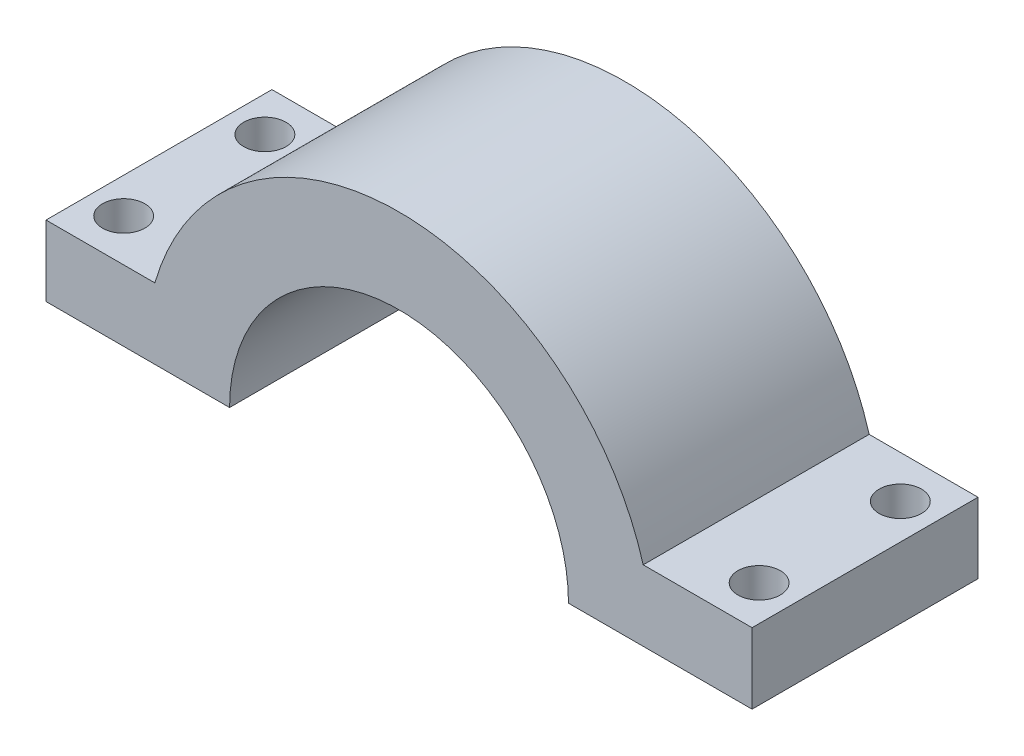
from build123d import *

# Parameters (mm, degrees)
BOSS_EXTRUDE1_DEPTH = 16
SKETCH14_R          = 1.5
CUT_EXTRUDE13_DEPTH = 50


with BuildPart() as part:
    # Sketch7 → Boss-Extrude1 (new body)
    with BuildSketch(Plane.XY):
        with BuildLine():
            Line((28.868798372, -27.16601268), (28.868798372, -22.16601268))
            Line((28.868798372, -22.16601268), (21.160414837, -22.16601268))
            ThreePointArc((21.160414837, -22.16601268), (3.868798372, -9.16601268), (-13.422818094, -22.16601268))
            Line((-13.422818094, -22.16601268), (-21.131201628, -22.16601268))
            Line((-21.131201628, -22.16601268), (-21.131201628, -27.16601268))
            Line((-21.131201628, -27.16601268), (-8.131201628, -27.16601268))
            ThreePointArc((-8.131201628, -27.16601268), (3.868798372, -15.16601268), (15.868798372, -27.16601268))
            Line((15.868798372, -27.16601268), (28.868798372, -27.16601268))
        make_face()
    extrude(amount=BOSS_EXTRUDE1_DEPTH)

    # Sketch14 → Cut-Extrude13 (cut)
    with BuildSketch(Plane(origin=(0, -27.16601268, 0), x_dir=(1, 0, 0), z_dir=(0, 1, 0))):
        with Locations((-18.631201628, -3)):
            Circle(SKETCH14_R)
        with Locations((-18.631201628, -13)):
            Circle(SKETCH14_R)
        with Locations((26.368798372, -3)):
            Circle(SKETCH14_R)
        with Locations((26.368798372, -13)):
            Circle(SKETCH14_R)
    extrude(amount=CUT_EXTRUDE13_DEPTH, mode=Mode.SUBTRACT)


solid = part.part
